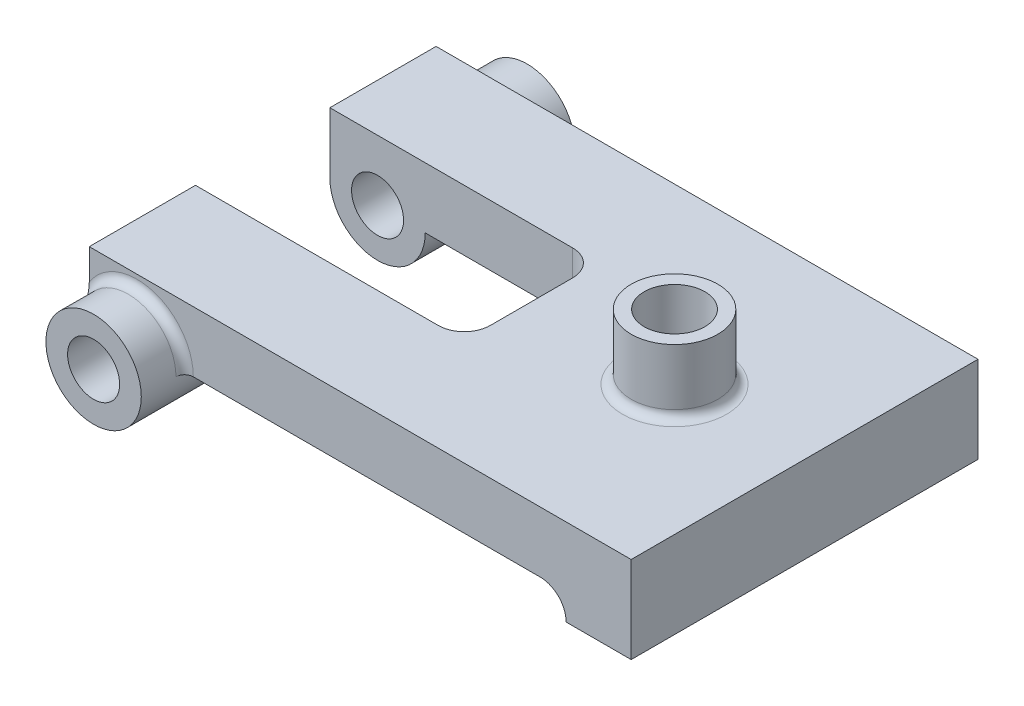
from build123d import *

# Parameters (mm, degrees)
BOSS_EXTRUDE3_DEPTH = 40
SKETCH1_5_R         = 11
SKETCH1_5_R_2       = 6
BOSS_EXTRUDE4_DEPTH = 50
SKETCH3_W           = 31
SKETCH3_H           = 25.003683984
CUT_EXTRUDE1_DEPTH  = 62
SKETCH4_R           = 10
SKETCH4_R_2         = 7
BOSS_EXTRUDE5_DEPTH = 15
FILLET1_R           = 2
FILLET2_R           = 6
CUT_EXTRUDE2_START  = -15
SKETCH4_2_R         = 7
CUT_EXTRUDE2_DEPTH  = 15


with BuildPart() as part:
    # Sketch1 → Boss-Extrude3 (new, symmetric)
    with BuildSketch(Plane.XY):
        with BuildLine():
            Line((125, 20), (0, 20))
            Line((0, 20), (0, 5.996316016))
            ThreePointArc((0, 5.996316016), (11, 16.996316016), (22, 5.996316016))
            Line((22, 5.996316016), (103.789775753, 5.996316016))
            ThreePointArc((103.789775753, 5.996316016), (108.167652488, 4.316326302), (110, 0))
            Line((110, 0), (125, 0))
            Line((125, 0), (125, 20))
        make_face()
    extrude(amount=BOSS_EXTRUDE3_DEPTH, both=True)

    # Sketch1<5> → Boss-Extrude4 (add, symmetric)
    with BuildSketch(Plane.XY):
        with Locations((11, 5.996316016)):
            Circle(SKETCH1_5_R)
        with Locations((11, 5.996316016)):
            Circle(SKETCH1_5_R_2, mode=Mode.SUBTRACT)
    extrude(amount=BOSS_EXTRUDE4_DEPTH, both=True)

    # Sketch3 → Cut-Extrude1 (cut)
    with BuildSketch(Plane.ZY):
        with Locations((0, 7.498158008)):
            Rectangle(SKETCH3_W, SKETCH3_H)
    extrude(amount=-CUT_EXTRUDE1_DEPTH, mode=Mode.SUBTRACT)

    # Sketch4 → Boss-Extrude5 (add)
    with BuildSketch(Plane(origin=(0, 20, 0), x_dir=(1, 0, 0), z_dir=(0, 1, 0))):
        with Locations(Location((95, 0, 0), (0, 0, 270))):
            Circle(SKETCH4_R)
        with Locations(Location((95, 0, 0), (0, 0, 270))):
            Circle(SKETCH4_R_2, mode=Mode.SUBTRACT)
    extrude(amount=BOSS_EXTRUDE5_DEPTH)

    # Fillet1
    # the kernel refuses this fillet: 2 mm, written as the material it adds along each edge
    with BuildSketch(Plane(origin=(11, 5.996316016, 40), x_dir=(-1, 0, 0), z_dir=(0, -1, 0))) as fillet1_piece_1_section:
        with BuildLine():
            CenterArc((11 + FILLET1_R, -FILLET1_R), FILLET1_R, 90, 90)
            Line((11 + FILLET1_R, 0), (11, 0))
            Line((11, 0), (11, -FILLET1_R))
        make_face()
    fillet1_piece_1 = revolve(axis=Axis((11, 5.996316016, 40), (0, 0, -1)), revolution_arc=180, mode=Mode.PRIVATE)
    fillet1_piece_1 = split(fillet1_piece_1, bisect_by=Plane(origin=(0, 17.026812535, 41), z_dir=(1, 0, 0)), keep=Keep.TOP, mode=Mode.PRIVATE)
    add(fillet1_piece_1)
    with BuildSketch(Plane(origin=(95, 20, 0), x_dir=(0, 0, 1), z_dir=(-1, 0, 0))) as fillet1_piece_2:
        with BuildLine():
            CenterArc((10 + FILLET1_R, FILLET1_R), FILLET1_R, 180, 90)
            Line((10, FILLET1_R), (10, 0))
            Line((10, 0), (10 + FILLET1_R, 0))
        make_face()
    revolve(axis=Axis((95, 20, 0), (0, 1, 0)))
    with BuildSketch(Plane(origin=(11, 5.996316016, -40), x_dir=(-1, 0, 0), z_dir=(0, -1, 0))) as fillet1_piece_3_section:
        with BuildLine():
            CenterArc((11 + FILLET1_R, FILLET1_R), FILLET1_R, 180, 90)
            Line((11 + FILLET1_R, 0), (11, 0))
            Line((11, 0), (11, FILLET1_R))
        make_face()
    fillet1_piece_3 = revolve(axis=Axis((11, 5.996316016, -40), (0, 0, -1)), revolution_arc=180, mode=Mode.PRIVATE)
    fillet1_piece_3 = split(fillet1_piece_3, bisect_by=Plane(origin=(0, 17.026812535, -41), z_dir=(1, 0, 0)), keep=Keep.TOP, mode=Mode.PRIVATE)
    add(fillet1_piece_3)

    # Fillet2
    fillet2_edges = [part.edges().sort_by_distance(p)[0] for p in [
        (62, 12.998158008, -15.5),
        (62, 12.998158008, 15.5),
    ]]
    fillet(fillet2_edges, radius=FILLET2_R)

    # Sketch4<2> → Cut-Extrude2 (cut)
    with BuildSketch(Plane(origin=(0, 20, 0), x_dir=(1, 0, 0), z_dir=(0, 1, 0)).offset(CUT_EXTRUDE2_START)):
        with Locations(Location((95, 0, 0), (0, 0, 90))):
            Circle(SKETCH4_2_R)
    extrude(amount=CUT_EXTRUDE2_DEPTH, mode=Mode.SUBTRACT)


solid = part.part
